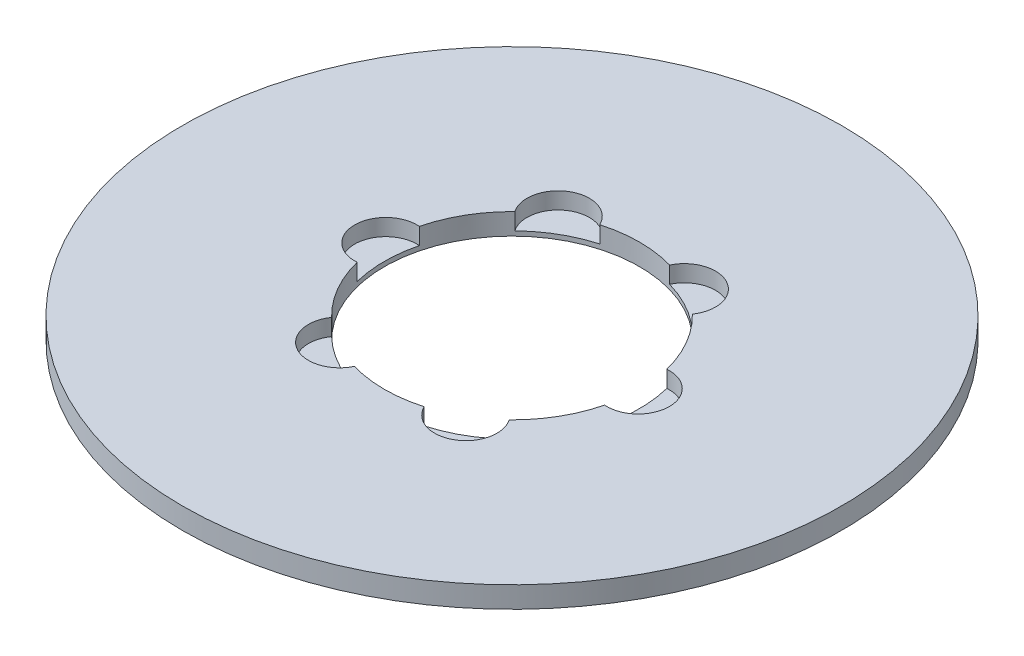
from build123d import *

# Parameters (mm, degrees)
SKETCH1_R           = 77.5
BOSS_EXTRUDE1_DEPTH = 5
SKETCH2_R           = 30
CUT_EXTRUDE1_DEPTH  = 110.715541287
SKETCH3_R           = 7.3352552
CUT_EXTRUDE2_DEPTH  = 3.913467054
CIRPATTERN1_COUNT   = 6


with BuildPart() as part:
    # Sketch1 → Boss-Extrude1 (new body)
    with BuildSketch(Plane(origin=(0, 0, 0), x_dir=(1, 0, 0), z_dir=(0, 1, 0))):
        Circle(SKETCH1_R)
    extrude(amount=BOSS_EXTRUDE1_DEPTH)

    # Sketch2 → Cut-Extrude1 (cut, through all)
    with BuildSketch(Plane(origin=(0, 0, 0), x_dir=(1, 0, 0), z_dir=(0, 1, 0))):
        Circle(SKETCH2_R)
    extrude(amount=CUT_EXTRUDE1_DEPTH, mode=Mode.SUBTRACT)

    # Sketch3 → Cut-Extrude2 (cut)
    with BuildSketch(Plane(origin=(0, 5, 0), x_dir=(1, 0, 0), z_dir=(0, 1, 0))):
        with Locations((-29.666344577, 0)):
            Circle(SKETCH3_R)
    cut_extrude2 = extrude(amount=-CUT_EXTRUDE2_DEPTH, mode=Mode.SUBTRACT)

    # CirPattern1: Cut-Extrude2 ×6 about axis
    cirpattern1_axis = Axis((0, 0, 0), (0, 1, 0))
    for i in range(1, CIRPATTERN1_COUNT):
        add(cut_extrude2.rotate(cirpattern1_axis, i * 360 / CIRPATTERN1_COUNT), mode=Mode.SUBTRACT)


solid = part.part
